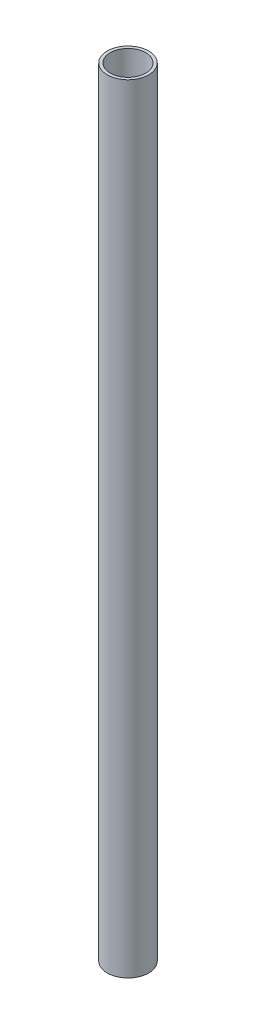
from build123d import *

# Parameters (mm, degrees)
SKETCH1_R           = 0.53213
SKETCH1_R_2         = 0.45593
BOSS_EXTRUDE1_DEPTH = 20


with BuildPart() as part:
    # Sketch1 → Boss-Extrude1 (new body)
    with BuildSketch(Plane(origin=(0, 0, 0), x_dir=(1, 0, 0), z_dir=(0, 1, 0))):
        Circle(SKETCH1_R)
        Circle(SKETCH1_R_2, mode=Mode.SUBTRACT)
    extrude(amount=BOSS_EXTRUDE1_DEPTH)


solid = part.part
